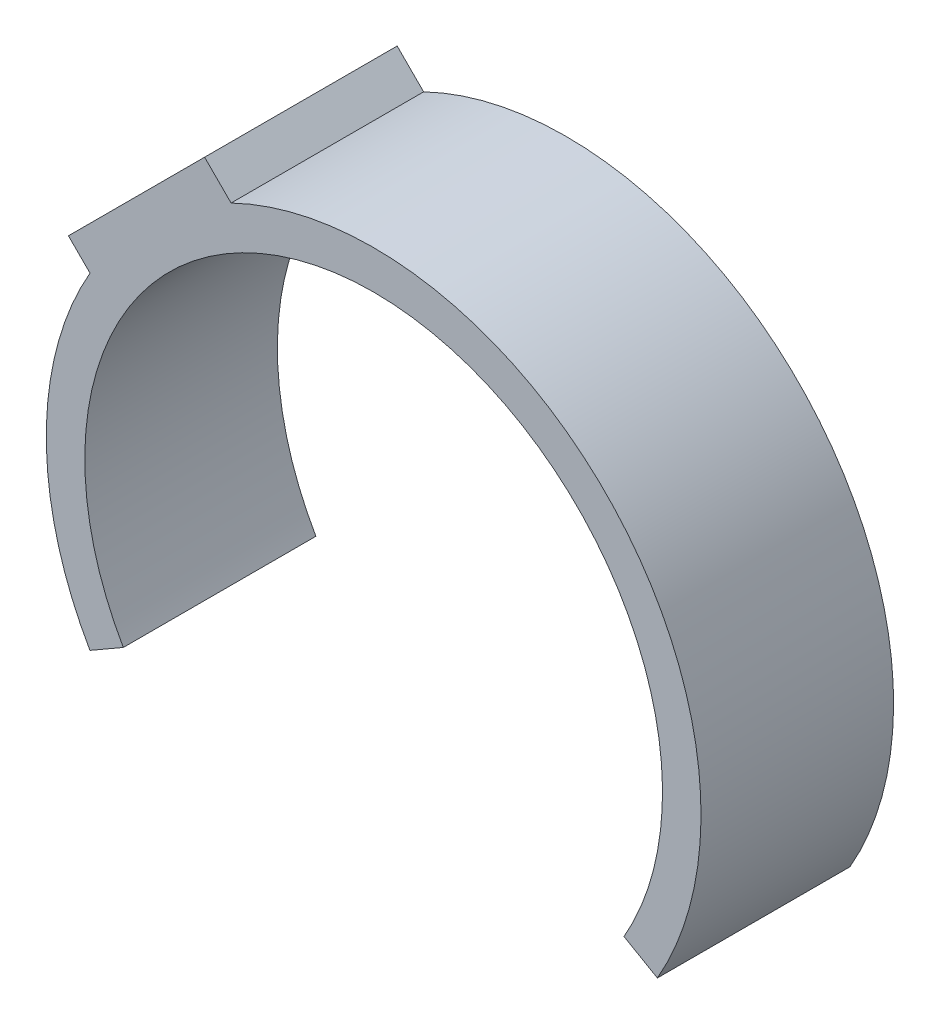
from build123d import *

# Parameters (mm, degrees)
BOSS_EXTRUDE2_DEPTH = 5
BOSS_EXTRUDE3_DEPTH = 5
SKETCH3_R           = 0.71884788
CUT_EXTRUDE1_DEPTH  = 5


# Read off the part's stored shape, not the designer's step: Boss-Extrude3
with BuildPart() as part:
    # Sketch1 → Boss-Extrude2 (new body)
    with BuildSketch(Plane.XY):
        with BuildLine():
            Line((-7.366666667, -4.240545038), (-6.5, -3.741657387))
            ThreePointArc((-6.5, -3.741657387), (-7.245688373, -1.936491673), (-7.5, 0))
            ThreePointArc((-7.5, 0), (0, 7.5), (7.5, 0))
            ThreePointArc((7.5, 0), (7.245688373, -1.936491673), (6.5, -3.741657387))
            Line((6.5, -3.741657387), (7.366666667, -4.240545038))
            ThreePointArc((7.366666667, -4.240545038), (8.211780156, -2.194690563), (8.5, 0))
            ThreePointArc((8.5, 0), (0, 8.5), (-8.5, 0))
            ThreePointArc((-8.5, 0), (-8.211780156, -2.194690563), (-7.366666667, -4.240545038))
        make_face()
    extrude(amount=BOSS_EXTRUDE2_DEPTH)

    # Boss-Extrude3 outline → Boss-Extrude3 (add)
    with BuildSketch(Plane.XY):
        with BuildLine():
            Line((-7.924926196, 4.802995865), (-7.365135024, 4.243204694))
            ThreePointArc((-7.365135024, 4.243204694), (-5.790125857, 6.222896638), (-3.702233025, 7.651370506))
            Line((-3.702233025, 7.651370506), (-4.38939229, 8.338529771))
            Line((-4.38939229, 8.338529771), (-7.924926196, 4.802995865))
        make_face()
    extrude(amount=BOSS_EXTRUDE3_DEPTH)

    # Sketch3 → Cut-Extrude1 (cut)
    with BuildSketch(Plane(origin=(-6.363961031, 6.363961031, 0), x_dir=(0, 0, 1), z_dir=(-0.7071067811865476, 0.7071067811865476, 0))):
        with Locations(Location((2.5, 0.292461893, 0), (0, 0, 270))):
            Circle(SKETCH3_R)
    extrude(amount=-CUT_EXTRUDE1_DEPTH, mode=Mode.SUBTRACT)


solid = part.part
